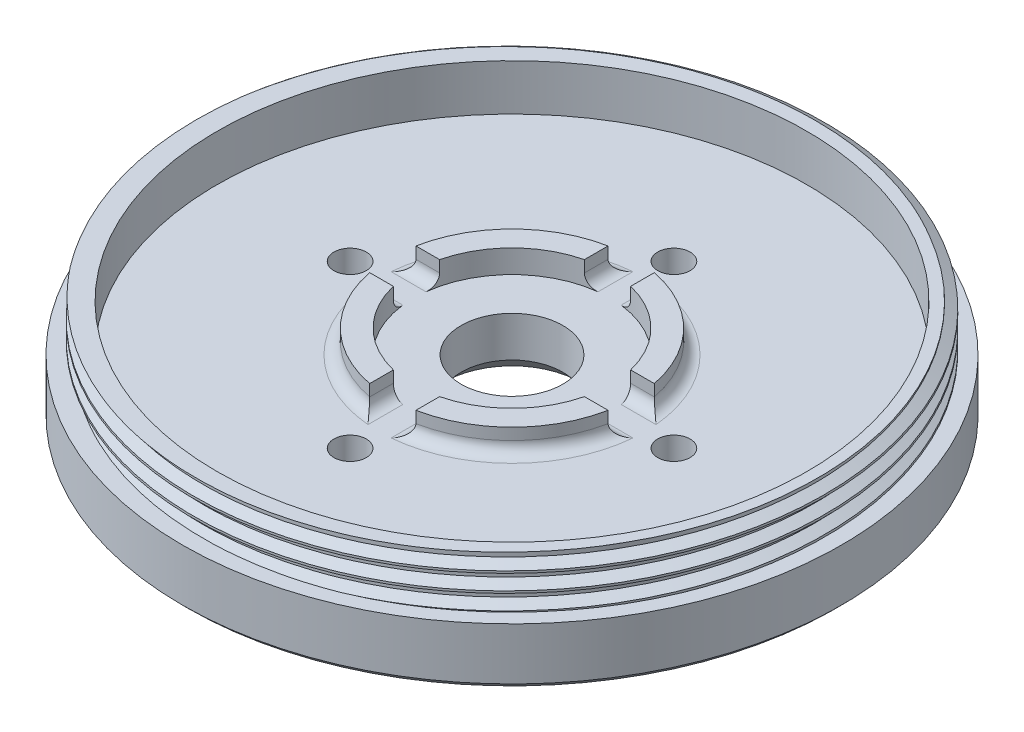
from build123d import *

# Parameters (mm, degrees)
SKETCH1_R       = 28.5
SKETCH1_R_2     = 4.4
SKETCH1_R_3     = 1.4
EXTRUDE1_DEPTH  = 5
SKETCH8_R       = 26.45
SKETCH8_R_2     = 25.5
EXTRUDE_1_DEPTH = 4
THREAD_1_PITCH  = 1.5
THREAD_1_FROM   = 2
EXTRUDE_2_DEPTH = 2
FILLET_1_R      = 1
CHAMFER2_SIZE   = 1.5
CHAMFER3_SIZE   = 0.5
CHAMFER4_SIZE   = 1


with BuildPart() as part:
    # Sketch1 → Extrude1 (new body)
    with BuildSketch(Plane(origin=(0, 0, 0), x_dir=(1, 0, 0), z_dir=(0, 1, 0))):
        with Locations(Location((0, 0, 0), (0, 0, 270))):
            Circle(SKETCH1_R)
        with Locations(Location((0, 0, 0), (0, 0, 270))):
            Circle(SKETCH1_R_2, mode=Mode.SUBTRACT)
        with Locations(Location((0, 14, 0), (0, 0, 270))):
            Circle(SKETCH1_R_3, mode=Mode.SUBTRACT)
        with Locations(Location((14, 0, 0), (0, 0, 270))):
            Circle(SKETCH1_R_3, mode=Mode.SUBTRACT)
        with Locations(Location((0, -14, 0), (0, 0, 270))):
            Circle(SKETCH1_R_3, mode=Mode.SUBTRACT)
        with Locations(Location((-14, 0, 0), (0, 0, 270))):
            Circle(SKETCH1_R_3, mode=Mode.SUBTRACT)
    extrude(amount=EXTRUDE1_DEPTH)

    # Sketch8 → Бобышка-Вытянуть1 (add)
    with BuildSketch(Plane(origin=(0, 5, 0), x_dir=(1, 0, 0), z_dir=(0, 1, 0))):
        with Locations(Location((0, 0, 0), (0, 0, 270))):
            Circle(SKETCH8_R)
        with Locations(Location((0, 0, 0), (0, 0, 270))):
            Circle(SKETCH8_R_2, mode=Mode.SUBTRACT)
    extrude(amount=EXTRUDE_1_DEPTH)

    # Резьба1: arcs per turn and ends read off the stored shape
    # Резьба1: the profile of Профиль резьбы1 profile screwed along a right-hand helix through 4 turns, 8 arcs to a turn; built about Z, then put on its axis
    thread_1_z = Axis((0, 0, 0), (0, 0, 1))
    thread_1_corners = [(26.4497, 0, -0.000173205), (27.261898813, 0, 0.468749998), (27.261898813, 0, 0.656249998), (26.4497, 0, 1.125173201)]
    with BuildLine(mode=Mode.PRIVATE) as thread_1_profile:
        Line(thread_1_corners[0], thread_1_corners[1])
        Line(thread_1_corners[1], thread_1_corners[2])
        Line(thread_1_corners[2], thread_1_corners[3])
        Line(thread_1_corners[3], thread_1_corners[0])
    thread_1_cap = Face(thread_1_profile.wire())
    thread_1_turn_angles = [0, 22.5, 45, 67.5, 90, 112.5, 135, 157.5, 180, 202.5, 225, 247.5, 270, 292.5, 315, 337.5, 360]
    thread_1_turn_weights = [1, 0.9238795325112867, 1, 0.9238795325112867, 1, 0.9238795325112867, 1, 0.9238795325112867, 1, 0.9238795325112867, 1, 0.9238795325112867, 1, 0.9238795325112867, 1, 0.9238795325112867, 1]
    thread_1_turn_rails = [Edge.make_bspline([Vector(p[0], p[1], 0).rotate(thread_1_z, thread_1_turn_angles[k]) / thread_1_turn_weights[k] + Vector(0, 0, p[2] + THREAD_1_PITCH * thread_1_turn_angles[k] / 360) for k in range(17)], [0, 0, 0, 1, 1, 2, 2, 3, 3, 4, 4, 5, 5, 6, 6, 7, 7, 8, 8, 8], 2, thread_1_turn_weights) for p in thread_1_corners]
    thread_1_turn_sides = [Face.make_surface_from_curves(thread_1_turn_rails[p[0]], thread_1_turn_rails[p[1]]) for p in [(0, 1), (1, 2), (2, 3), (3, 0)]]
    thread_1 = Plane(origin=(0, 11, 0), x_dir=(-1, 0, 0), z_dir=(0, -1, 0)) * split(Solid(Shell([*[p.moved(Location((0, 0, THREAD_1_PITCH * i))) for i in range(4) for p in thread_1_turn_sides], thread_1_cap, thread_1_cap.rotate(thread_1_z, 1440).moved(Location((0, 0, THREAD_1_PITCH * 1440 / 360)))])), bisect_by=Plane.XY.offset(THREAD_1_FROM), keep=Keep.TOP, mode=Mode.PRIVATE)
    add(thread_1)

    # Эскиз3 → Бобышка-Вытянуть2 (add)
    with BuildSketch(Plane(origin=(0, 5, 0), x_dir=(1, 0, 0), z_dir=(0, 1, 0))):
        with BuildLine():
            Line((-2, 10.307764064), (-2, 8.261355821))
            ThreePointArc((-2, 8.261355821), (-6.01040764, 6.01040764), (-8.261355821, 2))
            Line((-8.261355821, 2), (-10.307764064, 2))
            ThreePointArc((-10.307764064, 2), (-7.424621202, 7.424621202), (-2, 10.307764064))
        make_face()
        with BuildLine():
            Line((2, 10.307764064), (2, 8.261355821))
            ThreePointArc((2, 8.261355821), (6.01040764, 6.01040764), (8.261355821, 2))
            Line((8.261355821, 2), (10.307764064, 2))
            ThreePointArc((10.307764064, 2), (7.424621202, 7.424621202), (2, 10.307764064))
        make_face()
        with BuildLine():
            Line((10.307764064, -2), (8.261355821, -2))
            ThreePointArc((8.261355821, -2), (6.01040764, -6.01040764), (2, -8.261355821))
            Line((2, -8.261355821), (2, -10.307764064))
            ThreePointArc((2, -10.307764064), (7.424621202, -7.424621202), (10.307764064, -2))
        make_face()
        with BuildLine():
            Line((-2, -10.307764064), (-2, -8.261355821))
            ThreePointArc((-2, -8.261355821), (-6.01040764, -6.01040764), (-8.261355821, -2))
            Line((-8.261355821, -2), (-10.307764064, -2))
            ThreePointArc((-10.307764064, -2), (-7.424621202, -7.424621202), (-2, -10.307764064))
        make_face()
    extrude(amount=EXTRUDE_2_DEPTH)

    # Скругление1
    fillet_1_edges = [part.edges().sort_by_distance(p)[0] for p in [
        (-7.424621202, 5, -7.424621202),
        (-9.284559942, 5, -2),
        (-2, 5, -9.284559942),
        (7.424621202, 5, -7.424621202),
        (2, 5, -9.284559942),
        (9.284559942, 5, -2),
        (7.424621202, 5, 7.424621202),
        (9.284559942, 5, 2),
        (2, 5, 9.284559942),
        (-7.424621202, 5, 7.424621202),
        (-2, 5, 9.284559942),
        (-9.284559942, 5, 2),
    ]]
    fillet(fillet_1_edges, radius=FILLET_1_R)

    # Chamfer2
    chamfer2_edges = [part.edges().sort_by_distance(p)[0] for p in [
        (0, 0, -4.4),
    ]]
    chamfer(chamfer2_edges, length=CHAMFER2_SIZE)

    # Chamfer3
    chamfer3_edges = [part.edges().sort_by_distance(p)[0] for p in [
        (0, 0, -28.5),
    ]]
    chamfer(chamfer3_edges, length=CHAMFER3_SIZE)

    # Chamfer4
    chamfer4_edges = [part.edges().sort_by_distance(p)[0] for p in [
        (14, 0, -1.4),
        (0, 0, 12.6),
        (-14, 0, -1.4),
        (0, 0, -15.4),
    ]]
    chamfer(chamfer4_edges, length=CHAMFER4_SIZE)


solid = part.part
